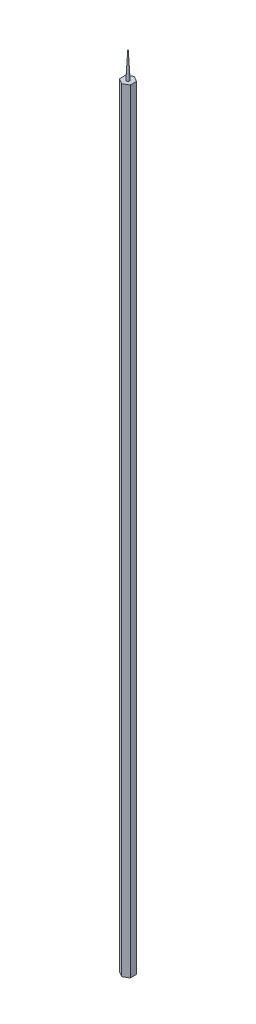
from build123d import *

# Parameters (mm, degrees)
P_IDAT_VYSUNUT_M1_DEPTH = 50


# Read off the part's stored shape, not the designer's step: Přidat vysunutím5
with BuildPart() as part:
    # Skica2 → Přidat vysunutím1 (new body)
    with BuildSketch(Plane(origin=(0, 0, 0), x_dir=(1, 0, 0), z_dir=(0, 1, 0))):
        Polygon((0, 0.404145188), (-0.35, 0.202072594), (-0.35, -0.202072594), (0, -0.404145188), (0.35, -0.202072594), (0.35, 0.202072594), align=None)
    extrude(amount=P_IDAT_VYSUNUT_M1_DEPTH)

    # Přidat vysunutím5 outline → Přidat vysunutím5 (revolve)
    with BuildSketch(Plane.XY):
        Polygon((0.1, 50), (0, 51.908113669), (0, 50), align=None)
    revolve(axis=Axis((0, 0, 0), (0, 1, 0)))


solid = part.part
